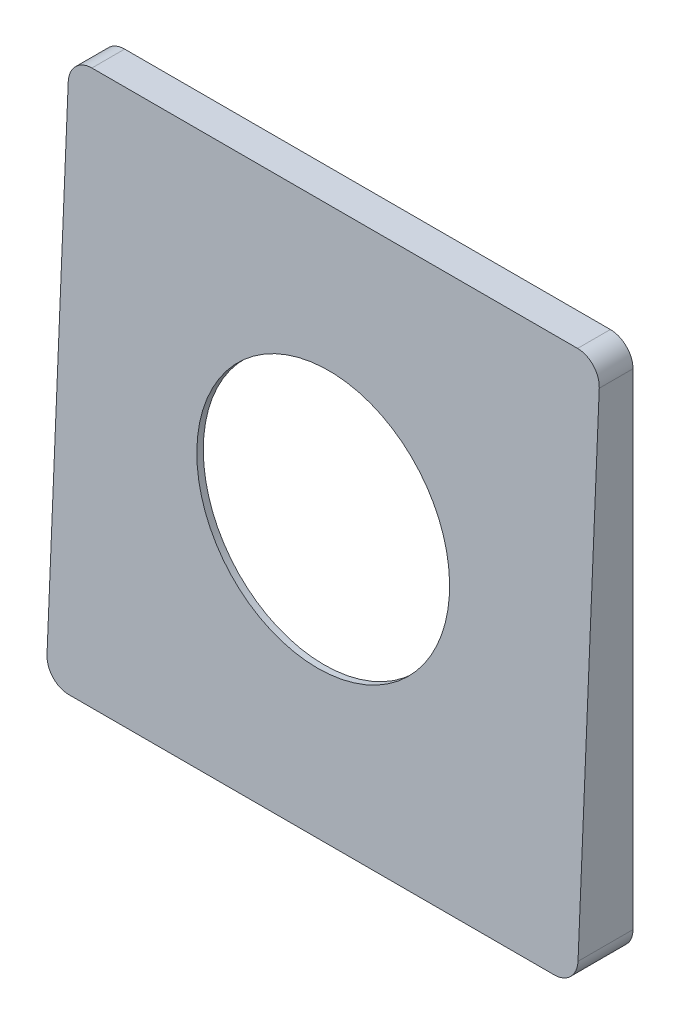
from build123d import *

# Parameters (mm, degrees)
EXTRUDE_THIN1_DEPTH     = 8
CUT_EXTRUDE2_DEPTH      = 120
BOSS_EXTRUDE1_DEPTH     = 82
CUT_EXTRUDE_THIN1_DEPTH = 82
SKETCH8_R               = 19.5
CUT_EXTRUDE3_DEPTH      = 82
EXTRUDE_THIN2_START     = 0.6
EXTRUDE_THIN2_DEPTH     = 0.6


with BuildPart() as part:
    # Sketch1 → Extrude-Thin1 (new body)
    with BuildSketch(Plane.XY):
        with BuildLine():
            Line((-37.5, 41), (37.5, 41))
            ThreePointArc((37.5, 41), (39.974873734, 39.974873734), (41, 37.5))
            Line((41, 37.5), (41, -37.5))
            ThreePointArc((41, -37.5), (39.974873734, -39.974873734), (37.5, -41))
            Line((37.5, -41), (-37.5, -41))
            ThreePointArc((-37.5, -41), (-39.974873734, -39.974873734), (-41, -37.5))
            Line((-41, -37.5), (-41, 37.5))
            ThreePointArc((-41, 37.5), (-39.974873734, 39.974873734), (-37.5, 41))
        make_face()
        with BuildLine():
            Line((-37.5, 40), (37.5, 40))
            ThreePointArc((37.5, 40), (39.267766953, 39.267766953), (40, 37.5))
            Line((40, 37.5), (40, -37.5))
            ThreePointArc((40, -37.5), (39.267766953, -39.267766953), (37.5, -40))
            Line((37.5, -40), (-37.5, -40))
            ThreePointArc((-37.5, -40), (-39.267766953, -39.267766953), (-40, -37.5))
            Line((-40, -37.5), (-40, 37.5))
            ThreePointArc((-40, 37.5), (-39.267766953, 39.267766953), (-37.5, 40))
        make_face(mode=Mode.SUBTRACT)
    extrude(amount=EXTRUDE_THIN1_DEPTH)

    # Sketch5 → Cut-Extrude2 (cut)
    with BuildSketch(Plane(origin=(41, 0, 0), x_dir=(0, 0, -1), z_dir=(1, 0, 0))):
        Polygon((-3.45625, 41), (-8, 41), (-8, -41), (-7.04375, -41), align=None)
    extrude(amount=-CUT_EXTRUDE2_DEPTH, mode=Mode.SUBTRACT)

    # Sketch6 → Boss-Extrude1 (add)
    with BuildSketch(Plane(origin=(41, 0, 0), x_dir=(0, 0, -1), z_dir=(1, 0, 0))):
        Polygon((-7.04375, -41), (-3.45625, 41), (-4.457206574, 41), (-8.044706574, -41), align=None)
    extrude(amount=-BOSS_EXTRUDE1_DEPTH)

    # Sketch7 → Cut-Extrude-Thin1 (cut)
    with BuildSketch(Plane(origin=(0, 0, 0), x_dir=(-1, 0, 0), z_dir=(0, 0, -1))):
        with BuildLine():
            Line((-37.5, 52), (37.5, 52))
            ThreePointArc((37.5, 52), (47.753048327, 47.753048327), (52, 37.5))
            Line((52, 37.5), (52, -37.5))
            ThreePointArc((52, -37.5), (47.753048327, -47.753048327), (37.5, -52))
            Line((37.5, -52), (-37.5, -52))
            ThreePointArc((-37.5, -52), (-47.753048327, -47.753048327), (-52, -37.5))
            Line((-52, -37.5), (-52, 37.5))
            ThreePointArc((-52, 37.5), (-47.753048327, 47.753048327), (-37.5, 52))
        make_face()
        with BuildLine():
            Line((-37.5, 41), (37.5, 41))
            ThreePointArc((37.5, 41), (39.974873734, 39.974873734), (41, 37.5))
            Line((41, 37.5), (41, -37.5))
            ThreePointArc((41, -37.5), (39.974873734, -39.974873734), (37.5, -41))
            Line((37.5, -41), (-37.5, -41))
            ThreePointArc((-37.5, -41), (-39.974873734, -39.974873734), (-41, -37.5))
            Line((-41, -37.5), (-41, 37.5))
            ThreePointArc((-41, 37.5), (-39.974873734, 39.974873734), (-37.5, 41))
        make_face(mode=Mode.SUBTRACT)
    extrude(amount=-CUT_EXTRUDE_THIN1_DEPTH, mode=Mode.SUBTRACT)

    # Sketch8 → Cut-Extrude3 (cut)
    with BuildSketch(Plane(origin=(0, 0.272956894, 6.23901471), x_dir=(1, 0, 0), z_dir=(0, 0.043708189893615426, 0.9990443404255007))):
        Circle(SKETCH8_R)
    extrude(amount=-CUT_EXTRUDE3_DEPTH, mode=Mode.SUBTRACT)

    # Sketch10 → Extrude-Thin2 (add)
    with BuildSketch(Plane(origin=(0, 0, 0), x_dir=(-1, 0, 0), z_dir=(0, 0, -1)).offset(EXTRUDE_THIN2_START)):
        with BuildLine():
            Line((-37.5, 41), (37.5, 41))
            ThreePointArc((37.5, 41), (39.974873734, 39.974873734), (41, 37.5))
            Line((41, 37.5), (41, -37.5))
            ThreePointArc((41, -37.5), (39.974873734, -39.974873734), (37.5, -41))
            Line((37.5, -41), (-37.5, -41))
            ThreePointArc((-37.5, -41), (-39.974873734, -39.974873734), (-41, -37.5))
            Line((-41, -37.5), (-41, 37.5))
            ThreePointArc((-41, 37.5), (-39.974873734, 39.974873734), (-37.5, 41))
        make_face()
        with BuildLine():
            Line((-37.5, 40), (37.5, 40))
            ThreePointArc((37.5, 40), (39.267766953, 39.267766953), (40, 37.5))
            Line((40, 37.5), (40, -37.5))
            ThreePointArc((40, -37.5), (39.267766953, -39.267766953), (37.5, -40))
            Line((37.5, -40), (-37.5, -40))
            ThreePointArc((-37.5, -40), (-39.267766953, -39.267766953), (-40, -37.5))
            Line((-40, -37.5), (-40, 37.5))
            ThreePointArc((-40, 37.5), (-39.267766953, 39.267766953), (-37.5, 40))
        make_face(mode=Mode.SUBTRACT)
    extrude(amount=-EXTRUDE_THIN2_DEPTH)


solid = part.part
